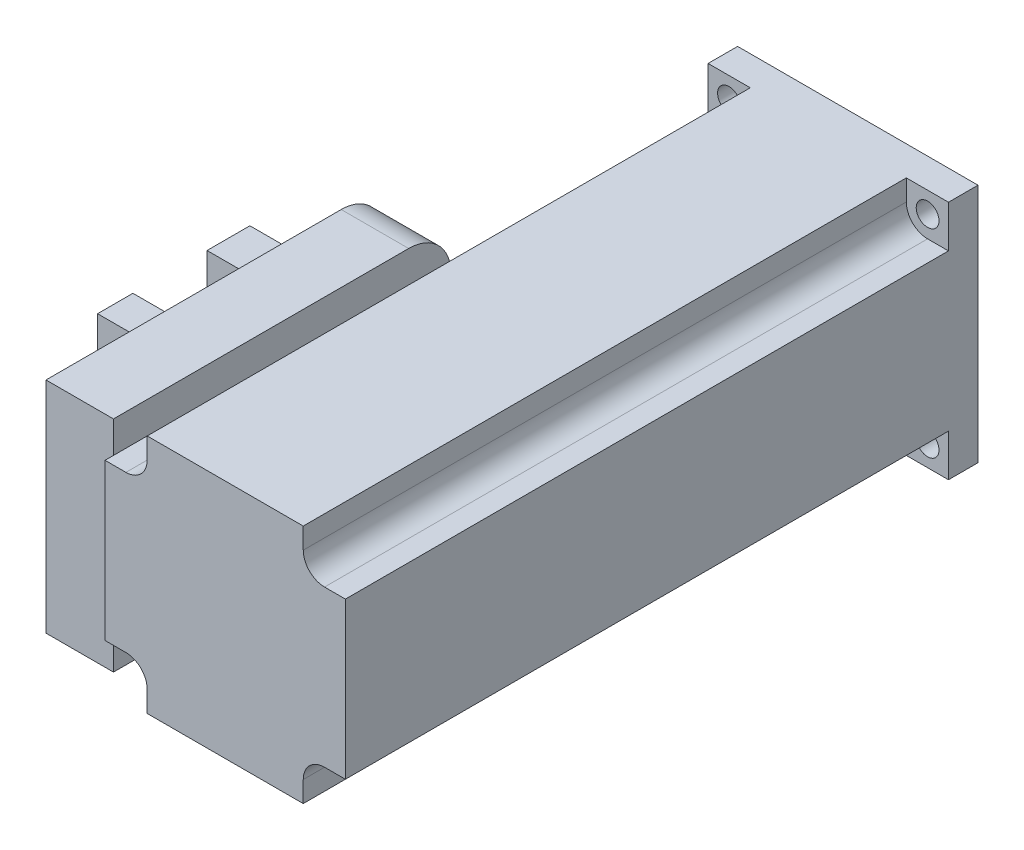
from build123d import *

# Parameters (mm, degrees)
SKIZZE1_W                       = 57
SKIZZE1_H                       = 57
AUFSATZ_LINEAR_AUSTRAGEN1_DEPTH = 150
SKIZZE2_R                       = 19.05
AUFSATZ_LINEAR_AUSTRAGEN2_DEPTH = 2
AUFSATZ_LINEAR_AUSTRAGEN3_DEPTH = 21
SKIZZE4_R                       = 2.7
SCHNITT_LINEAR_AUSTRAGEN1_DEPTH = 50
SCHNITT_LINEAR_START            = -7
SCHNITT_LINEAR_AUSTRAGEN2_DEPTH = 170
SKIZZE6_W                       = 80
SKIZZE6_H                       = 52
AUFSATZ_LINEAR_AUSTRAGEN4_DEPTH = 16
VERRUNDUNG1_R                   = 10
SKIZZE7_W                       = 10.157968888
SKIZZE7_H                       = 35.311034703
SKIZZE7_W_2                     = 8.384355272
AUFSATZ_LINEAR_AUSTRAGEN5_DEPTH = 16


with BuildPart() as part:
    # Skizze1 → Aufsatz-Linear austragen1 (new body)
    with BuildSketch(Plane.XY):
        Rectangle(SKIZZE1_W, SKIZZE1_H)
    extrude(amount=AUFSATZ_LINEAR_AUSTRAGEN1_DEPTH)

    # Skizze2 → Aufsatz-Linear austragen2 (add)
    with BuildSketch(Plane(origin=(0, 0, 0), x_dir=(-1, 0, 0), z_dir=(0, 0, -1))):
        with Locations(Location((0, 0, 0), (0, 0, 180))):
            Circle(SKIZZE2_R)
    extrude(amount=AUFSATZ_LINEAR_AUSTRAGEN2_DEPTH)

    # Skizze3 → Aufsatz-Linear austragen3 (add)
    with BuildSketch(Plane(origin=(0, 0, -2), x_dir=(-1, 0, 0), z_dir=(0, 0, -1))):
        with BuildLine():
            Line((-1.936491673, -3.5), (1.936491673, -3.5))
            ThreePointArc((1.936491673, -3.5), (0, 4), (-1.936491673, -3.5))
        make_face()
    extrude(amount=AUFSATZ_LINEAR_AUSTRAGEN3_DEPTH)

    # Skizze4 → Schnitt-Linear austragen1 (cut)
    with BuildSketch(Plane(origin=(0, 0, 0), x_dir=(-1, 0, 0), z_dir=(0, 0, -1))):
        with Locations((23.55, 23.55)):
            Circle(SKIZZE4_R)
        with Locations(Location((-23.55, 23.55, 0), (0, 0, 180))):
            Circle(SKIZZE4_R)
        with Locations(Location((23.55, -23.55, 0), (0, 0, 180))):
            Circle(SKIZZE4_R)
        with Locations((-23.55, -23.55)):
            Circle(SKIZZE4_R)
    extrude(amount=-SCHNITT_LINEAR_AUSTRAGEN1_DEPTH, mode=Mode.SUBTRACT)

    # Skizze5 → Schnitt-Linear austragen2 (cut)
    with BuildSketch(Plane(origin=(0, 0, 0), x_dir=(-1, 0, 0), z_dir=(0, 0, -1)).offset(SCHNITT_LINEAR_START)):
        with BuildLine():
            Line((18.5, 23.55), (18.5, 28.5))
            Line((18.5, 28.5), (28.5, 28.5))
            Line((28.5, 28.5), (28.5, 18.5))
            Line((28.5, 18.5), (23.55, 18.5))
            ThreePointArc((23.55, 18.5), (19.979110755, 19.979110755), (18.5, 23.55))
        make_face()
        with BuildLine():
            Line((-28.5, 28.5), (-28.5, 18.5))
            Line((-28.5, 18.5), (-23.55, 18.5))
            ThreePointArc((-23.55, 18.5), (-19.979110755, 19.979110755), (-18.5, 23.55))
            Line((-18.5, 23.55), (-18.5, 28.5))
            Line((-18.5, 28.5), (-28.5, 28.5))
        make_face()
        with BuildLine():
            Line((28.5, -18.5), (23.55, -18.5))
            ThreePointArc((23.55, -18.5), (19.979110755, -19.979110755), (18.5, -23.55))
            Line((18.5, -23.55), (18.5, -28.5))
            Line((18.5, -28.5), (28.5, -28.5))
            Line((28.5, -28.5), (28.5, -18.5))
        make_face()
        with BuildLine():
            Line((-28.5, -18.5), (-23.55, -18.5))
            ThreePointArc((-23.55, -18.5), (-19.979110755, -19.979110755), (-18.5, -23.55))
            Line((-18.5, -23.55), (-18.5, -28.5))
            Line((-18.5, -28.5), (-28.5, -28.5))
            Line((-28.5, -28.5), (-28.5, -18.5))
        make_face()
    extrude(amount=-SCHNITT_LINEAR_AUSTRAGEN2_DEPTH, mode=Mode.SUBTRACT)

    # Skizze6 → Aufsatz-Linear austragen4 (add)
    with BuildSketch(Plane.ZY.offset(28.5)):
        with Locations((108, 0)):
            Rectangle(SKIZZE6_W, SKIZZE6_H)
    extrude(amount=AUFSATZ_LINEAR_AUSTRAGEN4_DEPTH)

    # Verrundung1
    # the kernel refuses this fillet: 10 mm, written as the material it takes off along each edge
    with BuildSketch(Plane(origin=(-28.5, 26, 68), x_dir=(0, -1, 0), z_dir=(-1, 0, 0))) as verrundung1_piece_1:
        with BuildLine():
            CenterArc((VERRUNDUNG1_R, VERRUNDUNG1_R), VERRUNDUNG1_R, 180, 90)
            Line((0, VERRUNDUNG1_R), (0, 0))
            Line((0, 0), (VERRUNDUNG1_R, 0))
        make_face()
    extrude(amount=41, mode=Mode.SUBTRACT)
    with BuildSketch(Plane(origin=(-28.5, -26, 68), x_dir=(0, 1, 0), z_dir=(-1, 0, 0))) as verrundung1_piece_2:
        with BuildLine():
            CenterArc((VERRUNDUNG1_R, -VERRUNDUNG1_R), VERRUNDUNG1_R, 90, 90)
            Line((0, -VERRUNDUNG1_R), (0, 0))
            Line((0, 0), (VERRUNDUNG1_R, 0))
        make_face()
    extrude(amount=41, mode=Mode.SUBTRACT)

    # Skizze7 → Aufsatz-Linear austragen5 (add)
    with BuildSketch(Plane.ZY.offset(44.5)):
        with Locations((88.733684617, -0.161237601)):
            Rectangle(SKIZZE7_W, SKIZZE7_H)
        with Locations((115.579745248, -0.161237601)):
            Rectangle(SKIZZE7_W_2, SKIZZE7_H)
    extrude(amount=AUFSATZ_LINEAR_AUSTRAGEN5_DEPTH)


solid = part.part
